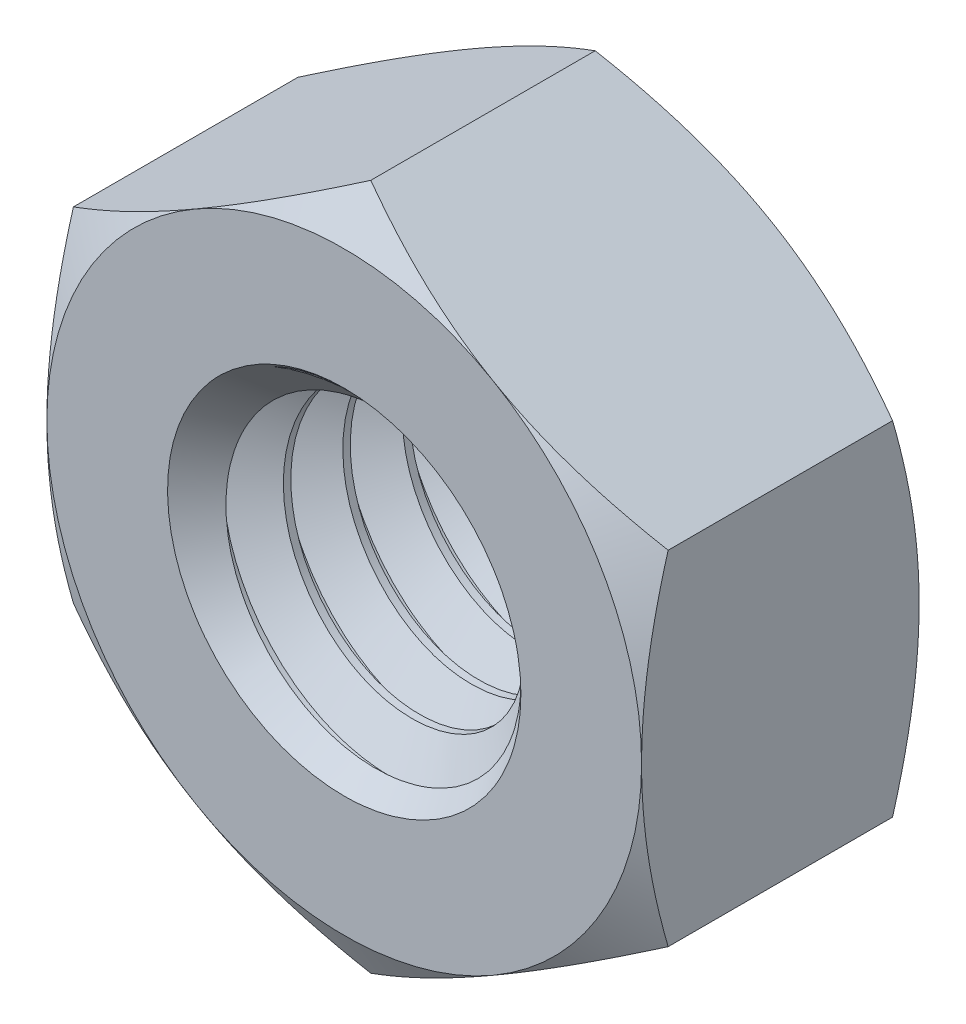
from build123d import *

# Parameters (mm, degrees)
BOSS_EXTRUDE1_DEPTH      = 1.4
BOSS_EXTRUDE1_DEPTH_BACK = 1.4
SKETCH2_R                = 1.75
SKETCH3_OUTSIDE_W        = 31.984
SKETCH3_OUTSIDE_H        = 32.912
SKETCH3_OUTSIDE_R        = 3
CUT_EXTRUDE1_DEPTH       = 6.370288633
CUT_EXTRUDE1_DRAFT       = -60
MIRROR1_COPY_1_SKETCH_W  = 31.984
MIRROR1_COPY_1_SKETCH_H  = 32.912
MIRROR1_COPY_1_SKETCH_R  = 3
MIRROR1_COPY_1_DEPTH     = 6.370288633
MIRROR1_COPY_1_DRAFT     = -60
SWEEP1_PITCH             = 0.6
SKETCH6_R                = 1.782475953
CUT_EXTRUDE2_DEPTH       = 6.717329171
SKETCH7_R                = 1.782475953
CUT_EXTRUDE3_DEPTH       = 6.370288741


with BuildPart() as part:
    # Sketch2 → Boss-Extrude1 (new, two sides: drawn at the far end of the back side and taken through both)
    with BuildSketch(Plane.XY.offset(-BOSS_EXTRUDE1_DEPTH_BACK)):
        Polygon((0, 3.464101615), (-3, 1.732050808), (-3, -1.732050808), (0, -3.464101615), (3, -1.732050808), (3, 1.732050808), align=None)
        Circle(SKETCH2_R, mode=Mode.SUBTRACT)
    extrude(amount=BOSS_EXTRUDE1_DEPTH + BOSS_EXTRUDE1_DEPTH_BACK)


with BuildPart() as cut_extrude1_tool:
    # Sketch3 outside → Cut-Extrude1 (with draft: the straight prism first)
    with BuildSketch(Plane.XY.offset(1.4)):
        Rectangle(SKETCH3_OUTSIDE_W, SKETCH3_OUTSIDE_H)
        Circle(SKETCH3_OUTSIDE_R, mode=Mode.SUBTRACT)
    extrude(amount=-CUT_EXTRUDE1_DEPTH)
    # Cut-Extrude1: the draft: its side faces are tilted about the plane it starts from
    cut_extrude1_sides = [cut_extrude1_tool.faces().sort_by_distance(p)[0] for p in [
        (0, -16.456, -1.785144316),
        (15.992, 0, -1.785144316),
        (0, 16.456, -1.785144316),
        (-15.992, 0, -1.785144316),
        (-3, 0, -1.785144316),
    ]]
    draft(cut_extrude1_sides, Plane.XY.offset(1.4), CUT_EXTRUDE1_DRAFT)


with BuildPart() as part_1:
    add(part.part)

    # Cut-Extrude1: cut by cut_extrude1_tool
    add(cut_extrude1_tool.part, mode=Mode.SUBTRACT)


with BuildPart() as mirror1_copy_1_tool:
    # Mirror1 copy 1 sketch → Mirror1 copy 1 (with draft: the straight prism first)
    with BuildSketch(Plane(origin=(0, 0, -1.4), x_dir=(1, 0, 0), z_dir=(0, 0, -1))):
        Rectangle(MIRROR1_COPY_1_SKETCH_W, MIRROR1_COPY_1_SKETCH_H)
        Circle(MIRROR1_COPY_1_SKETCH_R, mode=Mode.SUBTRACT)
    extrude(amount=-MIRROR1_COPY_1_DEPTH)
    # Mirror1 copy 1: the draft: its side faces are tilted about the plane it starts from
    mirror1_copy_1_sides = [mirror1_copy_1_tool.faces().sort_by_distance(p)[0] for p in [
        (0, -16.456, 1.785144316),
        (15.992, 0, 1.785144316),
        (0, 16.456, 1.785144316),
        (-15.992, 0, 1.785144316),
        (-3, 0, 1.785144316),
    ]]
    draft(mirror1_copy_1_sides, Plane(origin=(0, 0, -1.4), x_dir=(1, 0, 0), z_dir=(0, 0, -1)), MIRROR1_COPY_1_DRAFT)


with BuildPart() as part_2:
    add(part_1.part)

    # Mirror1 copy 1: cut by mirror1_copy_1_tool
    add(mirror1_copy_1_tool.part, mode=Mode.SUBTRACT)

    # Sweep1: the profile of Sketch4 screwed along a right-hand helix of 5.666667 turns, 6 arcs to a turn; built about Z, then put on its axis
    sweep1_z = Axis((0, 0, 0), (0, 0, 1))
    sweep1_corners = [(1.782475953, 0, -0.54375), (1.360288568, 0, -0.3), (1.360288568, 0, -0.225), (1.782475953, 0, 0.01875)]
    with BuildLine(mode=Mode.PRIVATE) as sweep1_profile:
        Line(sweep1_corners[0], sweep1_corners[1])
        Line(sweep1_corners[1], sweep1_corners[2])
        Line(sweep1_corners[2], sweep1_corners[3])
        Line(sweep1_corners[3], sweep1_corners[0])
    sweep1_cap = Face(sweep1_profile.wire())
    sweep1_turn_angles = [0, 30, 60, 90, 120, 150, 180, 210, 240, 270, 300, 330, 360]
    sweep1_turn_weights = [1, 0.8660254037844387, 1, 0.8660254037844387, 1, 0.8660254037844387, 1, 0.8660254037844387, 1, 0.8660254037844387, 1, 0.8660254037844387, 1]
    sweep1_turn_rails = [Edge.make_bspline([Vector(p[0], p[1], 0).rotate(sweep1_z, sweep1_turn_angles[k]) / sweep1_turn_weights[k] + Vector(0, 0, p[2] + SWEEP1_PITCH * sweep1_turn_angles[k] / 360) for k in range(13)], [0, 0, 0, 1, 1, 2, 2, 3, 3, 4, 4, 5, 5, 6, 6, 6], 2, sweep1_turn_weights) for p in sweep1_corners]
    sweep1_turn_sides = [Face.make_surface_from_curves(sweep1_turn_rails[p[0]], sweep1_turn_rails[p[1]]) for p in [(0, 1), (1, 2), (2, 3), (3, 0)]]
    sweep1_last_angles = [1800, 1830, 1860, 1890, 1920, 1950, 1980, 2010, 2040]
    sweep1_last_weights = [1, 0.8660254037844387, 1, 0.8660254037844387, 1, 0.8660254037844387, 1, 0.866025403784269, 1]
    sweep1_last_rails = [Edge.make_bspline([Vector(p[0], p[1], 0).rotate(sweep1_z, sweep1_last_angles[k]) / sweep1_last_weights[k] + Vector(0, 0, p[2] + SWEEP1_PITCH * sweep1_last_angles[k] / 360) for k in range(9)], [0, 0, 0, 1, 1, 2, 2, 3, 3, 4, 4, 4], 2, sweep1_last_weights) for p in sweep1_corners]
    sweep1_last_sides = [Face.make_surface_from_curves(sweep1_last_rails[p[0]], sweep1_last_rails[p[1]]) for p in [(0, 1), (1, 2), (2, 3), (3, 0)]]
    sweep1 = Plane(origin=(0, 0, 1.4), x_dir=(0, 1, 0), z_dir=(0, 0, -1)) * Solid(Shell([*[p.moved(Location((0, 0, SWEEP1_PITCH * i))) for i in range(5) for p in sweep1_turn_sides], *sweep1_last_sides, sweep1_cap, sweep1_cap.rotate(sweep1_z, 2040).moved(Location((0, 0, SWEEP1_PITCH * 2040 / 360)))]))
    add(sweep1)

    # Sketch6 → Cut-Extrude2 (cut)
    with BuildSketch(Plane.XY.offset(1.4)):
        Circle(SKETCH6_R)
    extrude(amount=CUT_EXTRUDE2_DEPTH, mode=Mode.SUBTRACT)

    # Cut-Extrude2 cone 1 section (through the dimple's axis) → Cut-Extrude2 other way (revolve, cut)
    with BuildSketch(Plane(origin=(0, 0, 1.4), x_dir=(0, -1, 0), z_dir=(1, 0, 0))):
        Polygon((0, 0), (1.782475953, 0), (0, 1.782475953), align=None)
    revolve(axis=Axis((0, 0, 1.4), (0, 0, -1)), mode=Mode.SUBTRACT)

    # Sketch7 → Cut-Extrude3 (cut)
    with BuildSketch(Plane(origin=(0, 0, -1.4), x_dir=(-1, 0, 0), z_dir=(0, 0, -1))):
        Circle(SKETCH7_R)
    extrude(amount=CUT_EXTRUDE3_DEPTH, mode=Mode.SUBTRACT)

    # Cut-Extrude3 cone 1 section (through the dimple's axis) → Cut-Extrude3 other way (revolve, cut)
    with BuildSketch(Plane(origin=(0, 0, -1.4), x_dir=(0, 1, 0), z_dir=(1, 0, 0))):
        Polygon((0, 0), (1.782475953, 0), (0, 1.782475953), align=None)
    revolve(axis=Axis((0, 0, -1.4), (0, 0, 1)), mode=Mode.SUBTRACT)


solid = part_2.part
